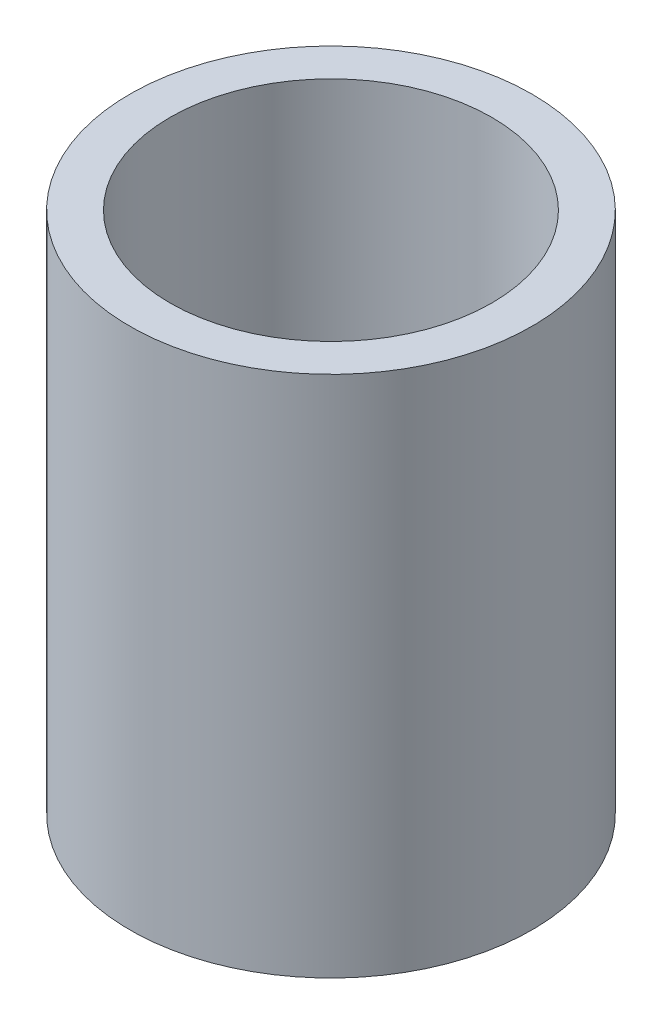
from build123d import *

# Parameters (mm, degrees)
SKETCH1_R           = 5
SKETCH1_R_2         = 4
BOSS_EXTRUDE1_DEPTH = 13


with BuildPart() as part:
    # Sketch1 → Boss-Extrude1 (new body)
    with BuildSketch(Plane(origin=(0, 0, 0), x_dir=(1, 0, 0), z_dir=(0, 1, 0))):
        Circle(SKETCH1_R)
        Circle(SKETCH1_R_2, mode=Mode.SUBTRACT)
    extrude(amount=BOSS_EXTRUDE1_DEPTH)


solid = part.part
